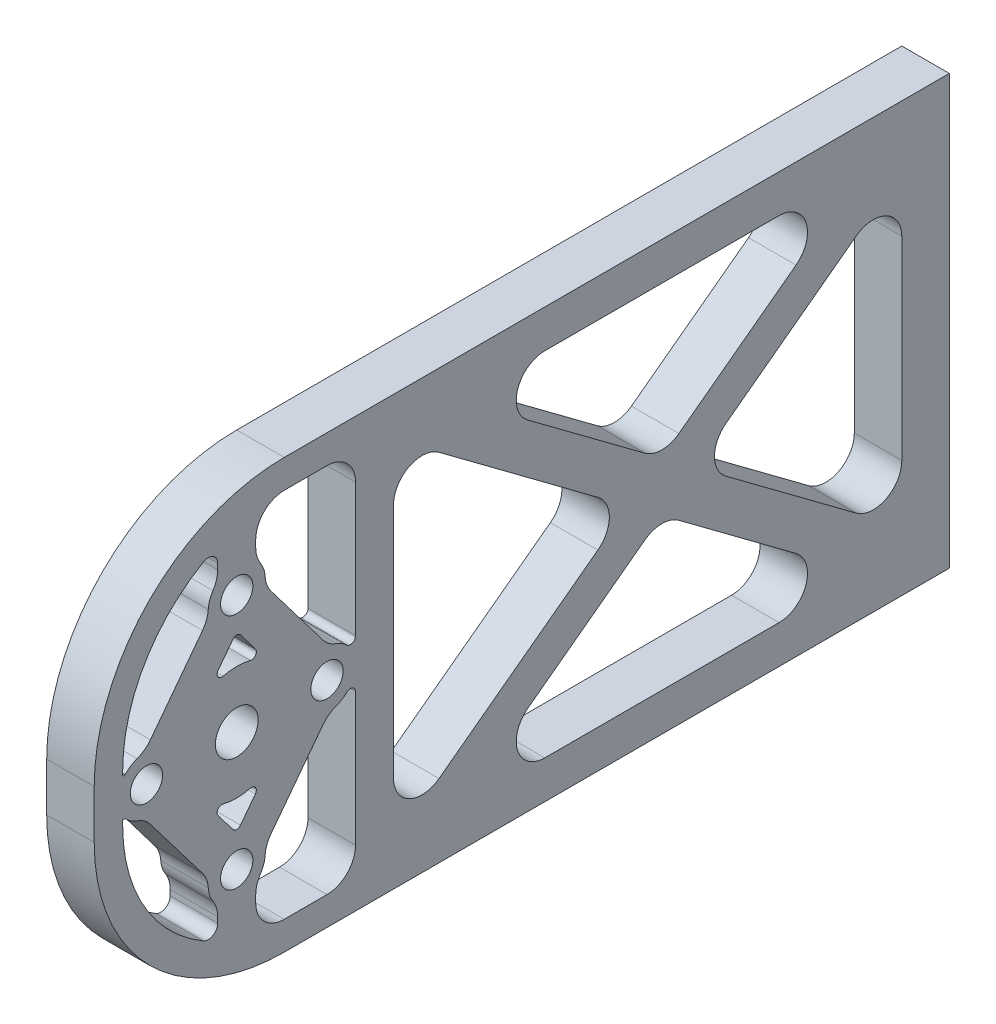
from build123d import *

# Parameters (mm, degrees)
SKETCH1_W           = 5
SKETCH1_H           = 45.1
BOSS_EXTRUDE1_DEPTH = 90
CUT_EXTRUDE1_DEPTH  = 3.9
SKETCH3_R           = 2.25
SKETCH3_R_2         = 1.7
CUT_EXTRUDE2_DEPTH  = 16.6
FILLET1_R           = 19.999999878
CUT_EXTRUDE8_DEPTH  = 15.24
FILLET3_R           = 3
FILLET4_R           = 3
FILLET6_DEPTH       = 5
FILLET7_DEPTH       = 5
FILLET8_R           = 3
FILLET9_R           = 1
FILLET10_R          = 1
FILLET14_R          = 3
FILLET15_R          = 0.5


with BuildPart() as part:
    # Sketch1 → Boss-Extrude1 (new body)
    with BuildSketch(Plane.XY):
        with Locations((2.5, 22.55)):
            Rectangle(SKETCH1_W, SKETCH1_H)
    extrude(amount=BOSS_EXTRUDE1_DEPTH)

    # Sketch2 → Cut-Extrude1 (cut)
    with BuildSketch(Plane(origin=(0, 0, 0), x_dir=(-1, 0, 0), z_dir=(0, 0, -1))):
        with BuildLine():
            ThreePointArc((-0.25, 37.55), (-0.909009742, 39.140990258), (-2.5, 39.8))
            Line((-2.5, 39.8), (-2.5, 35.3))
            ThreePointArc((-2.5, 35.3), (-0.909009742, 35.959009742), (-0.25, 37.55))
        make_face()
        with BuildLine():
            Line((-2.5, 35.3), (-2.5, 39.8))
            ThreePointArc((-2.5, 39.8), (-4.75, 37.55), (-2.5, 35.3))
        make_face()
        with BuildLine():
            ThreePointArc((-0.25, 7.55), (-0.909009742, 9.140990258), (-2.5, 9.8))
            Line((-2.5, 9.8), (-2.5, 5.3))
            ThreePointArc((-2.5, 5.3), (-0.909009742, 5.959009742), (-0.25, 7.55))
        make_face()
        with BuildLine():
            Line((-2.5, 5.3), (-2.5, 9.8))
            ThreePointArc((-2.5, 9.8), (-4.75, 7.55), (-2.5, 5.3))
        make_face()
    extrude(amount=-CUT_EXTRUDE1_DEPTH, mode=Mode.SUBTRACT)

    # Sketch3 → Cut-Extrude2 (cut)
    with BuildSketch(Plane.ZY):
        with Locations((75, 22.55)):
            Circle(SKETCH3_R)
        with Locations((84.5, 22.55)):
            Circle(SKETCH3_R_2)
        with Locations((65.5, 22.55)):
            Circle(SKETCH3_R_2)
        with Locations((75, 10.05)):
            Circle(SKETCH3_R_2)
        with Locations((75, 35.05)):
            Circle(SKETCH3_R_2)
    extrude(amount=-CUT_EXTRUDE2_DEPTH, mode=Mode.SUBTRACT)

    # Fillet1
    fillet1_edges = [part.edges().sort_by_distance(p)[0] for p in [
        (2.5, 45.1, 90),
        (2.5, 0, 90),
    ]]
    fillet(fillet1_edges, radius=FILLET1_R)

    # Sketch4 → Cut-Extrude8 (cut)
    with BuildSketch(Plane.ZY):
        with BuildLine():
            Line((70.000000122, 42.1), (63.145751292, 42.1))
            ThreePointArc((63.145751292, 42.1), (62.834437577, 41.851861901), (62.499999981, 41.635898385))
            Line((62.499999981, 41.635898385), (62.499999981, 24.55))
            Line((62.499999981, 24.55), (63.263932023, 24.55))
            ThreePointArc((63.263932023, 24.55), (64.16691137, 25.237540642), (65.26068293, 25.540439322))
            Line((65.26068293, 25.540439322), (72.054668294, 34.479893748))
            ThreePointArc((72.054668294, 34.479893748), (72.156985777, 36.007742202), (73, 37.286067977))
            Line((73, 37.286067977), (73, 41.833200551))
            ThreePointArc((73, 41.833200551), (71.505920207, 42.033168773), (70.000000122, 42.1))
        make_face()
        with BuildLine():
            ThreePointArc((87, 25.100000122), (84.282856855, 34.319544546), (77, 40.591933428))
            Line((77, 40.591933428), (77, 37.286067977))
            ThreePointArc((77, 37.286067977), (77.738612788, 36.274744871), (78, 35.05))
            ThreePointArc((78, 35.05), (77.986301653, 34.763639318), (77.945331706, 34.479893748))
            Line((77.945331706, 34.479893748), (84.73931707, 25.540439322))
            ThreePointArc((84.73931707, 25.540439322), (85.83308863, 25.237540642), (86.736067977, 24.55))
            Line((86.736067977, 24.55), (87, 24.55))
            Line((87, 24.55), (87, 25.100000122))
        make_face()
        with BuildLine():
            Line((87, 19.999999878), (87, 20.55))
            Line((87, 20.55), (86.736067977, 20.55))
            ThreePointArc((86.736067977, 20.55), (85.83308863, 19.862459358), (84.73931707, 19.559560678))
            Line((84.73931707, 19.559560678), (77.945331706, 10.620106252))
            ThreePointArc((77.945331706, 10.620106252), (77.986301653, 10.336360682), (78, 10.05))
            ThreePointArc((78, 10.05), (77.738612788, 8.825255129), (77, 7.813932023))
            Line((77, 7.813932023), (77, 4.508066572))
            ThreePointArc((77, 4.508066572), (84.282856855, 10.780455454), (87, 19.999999878))
        make_face()
        with BuildLine():
            Line((71.929872481, 17.394971677), (75, 13.355330204))
            Line((75, 13.355330204), (78.070127519, 17.394971677))
            ThreePointArc((78.070127519, 17.394971677), (75, 16.55), (71.929872481, 17.394971677))
        make_face()
        with BuildLine():
            Line((78.070127519, 27.705028323), (75, 31.744669796))
            Line((75, 31.744669796), (71.929872481, 27.705028323))
            ThreePointArc((71.929872481, 27.705028323), (75, 28.55), (78.070127519, 27.705028323))
        make_face()
        with BuildLine():
            ThreePointArc((62.499999981, 3.464101615), (62.834437577, 3.248138099), (63.145751292, 3))
            Line((63.145751292, 3), (70.000000122, 3))
            ThreePointArc((70.000000122, 3), (71.505920207, 3.066831227), (73, 3.266799449))
            Line((73, 3.266799449), (73, 7.813932023))
            ThreePointArc((73, 7.813932023), (72.156985777, 9.092257798), (72.054668294, 10.620106252))
            Line((72.054668294, 10.620106252), (65.26068293, 19.559560678))
            ThreePointArc((65.26068293, 19.559560678), (64.16691137, 19.862459358), (63.263932023, 20.55))
            Line((63.263932023, 20.55), (62.499999981, 20.55))
            Line((62.499999981, 20.55), (62.499999981, 3.464101615))
        make_face()
        Polygon((58.499999981, 40.989807049), (33.763673459, 22.55), (58.499999981, 4.110192951), (58.499999981, 22.550000019), align=None)
        Polygon((51.620472856, 4), (30.249999991, 19.930716141), (8.879527125, 4), align=None)
        Polygon((26.736326522, 22.55), (5, 38.753443412), (5, 6.346556588), align=None)
        Polygon((51.620472856, 41.1), (8.879527125, 41.1), (30.24999999, 25.169283859), align=None)
    extrude(amount=-CUT_EXTRUDE8_DEPTH, mode=Mode.SUBTRACT)

    # Fillet3
    fillet3_edges = [part.edges().sort_by_distance(p)[0] for p in [
        (2.5, 22.55, 33.763673459),
        (2.5, 40.989807049, 58.499999981),
        (2.5, 4.110192951, 58.499999981),
        (2.5, 38.753443412, 5),
        (2.5, 22.55, 26.736326522),
        (2.5, 6.346556588, 5),
        (2.5, 19.930716141, 30.249999991),
        (2.5, 4, 51.620472856),
        (2.5, 4, 8.879527125),
        (2.5, 41.1, 8.879527125),
        (2.5, 41.1, 51.620472856),
        (2.5, 25.169283859, 30.24999999),
    ]]
    fillet(fillet3_edges, radius=FILLET3_R)

    # Fillet4
    # the kernel refuses this fillet: 3 mm, written as the material it adds along each edge
    with BuildSketch(Plane(origin=(0, 41.635898385, 62.499999981), x_dir=(0, -1, 0), z_dir=(1, 0, 0))) as fillet4_piece_1:
        with BuildLine():
            CenterArc((2.535898385, -3), FILLET4_R, 90, 90)
            Line((-0.464101615, -3), (-0.764101615, -3))
            ThreePointArc((-0.764101615, -3), (-0.764101615, -0.645751311), (-0.259807621, 0.15))
            Line((-0.259807621, 0.15), (0, 0.3))
            Line((0, 0.3), (2.535898385, 0.3))
            Line((2.535898385, 0.3), (2.535898385, 0))
        make_face()
    extrude(amount=5)
    with BuildSketch(Plane(origin=(0, 42.1, 63.145751292), x_dir=(0, -0.977608773427827, -0.21043071571645502), z_dir=(1, 0, 0))) as fillet4_piece_2:
        with BuildLine():
            CenterArc((2.437420084, -2.93282632), FILLET4_R, 77.852405527, 90)
            Line((-0.495406237, -2.301534173), (-0.788688869, -2.238404958))
            Line((-0.788688869, -2.238404958), (-0.293282632, 0.063129215))
            Line((-0.293282632, 0.063129215), (-0.178205923, 0.241335138))
            ThreePointArc((-0.178205923, 0.241335138), (0.652724936, 0.826913544), (3.131841446, 0.293282632))
            Line((3.131841446, 0.293282632), (3.068712231, 0))
        make_face()
    extrude(amount=5)

    # Fillet6: read off the stored shape, not the designer's step
    # Fillet6 outline → Fillet6 (add)
    with BuildSketch(Plane.YZ):
        with BuildLine():
            add(Edge.make_bspline(
                [(24.550000002, 63.035898372), (24.550000007, 62.701238666), (24.793297494, 62.499999979), (25.085898405, 62.499999981)],
                knots=[0.347174193, 0.347174193, 0.347174193, 0.347174193, 1, 1, 1, 1], degree=3, weights=[0.723179501, 0.641942058, 0.734215557, 1]))
            Line((24.550000002, 63.035898372), (24.55, 62.499999981))
            Line((24.55, 62.499999981), (25.085898405, 62.499999981))
        make_face()
        with BuildLine():
            add(Edge.make_bspline(
                [(24.701559333, 63.409355976), (24.608835926, 63.313930877), (24.549999999, 63.184973167), (24.550000002, 63.035898372)],
                knots=[0, 0, 0, 0, 0.347174193, 0.347174193, 0.347174193, 0.347174193], degree=3, weights=[1, 0.858655251, 0.766381752, 0.723179501]))
            ThreePointArc((24.701559333, 63.409355976), (24.627052781, 63.335317173), (24.55, 63.263932023))
            Line((24.55, 63.263932023), (24.550000002, 63.035898372))
        make_face()
    extrude(amount=FILLET6_DEPTH)

    # Fillet7: read off the stored shape, not the designer's step
    # Fillet7 outline → Fillet7 (add)
    with BuildSketch(Plane.YZ):
        with BuildLine():
            add(Edge.make_bspline(
                [(20.55, 63.035898371), (20.550000002, 63.184973166), (20.491164076, 63.313930876), (20.398440668, 63.409355974)],
                knots=[0.652825805, 0.652825805, 0.652825805, 0.652825805, 1, 1, 1, 1], degree=3, weights=[0.723179502, 0.766381752, 0.858655251, 1]))
            Line((20.55, 63.035898371), (20.55, 63.263932023))
            ThreePointArc((20.55, 63.263932023), (20.47294722, 63.335317172), (20.398440668, 63.409355974))
        make_face()
        with BuildLine():
            add(Edge.make_bspline(
                [(20.014101602, 62.499999981), (20.306702509, 62.499999981), (20.549999995, 62.701238667), (20.55, 63.035898371)],
                knots=[0, 0, 0, 0, 0.652825805, 0.652825805, 0.652825805, 0.652825805], degree=3, weights=[1, 0.734215559, 0.641942059, 0.723179502]))
            Line((20.014101602, 62.499999981), (20.55, 62.499999981))
            Line((20.55, 62.499999981), (20.55, 63.035898371))
        make_face()
    extrude(amount=FILLET7_DEPTH)

    # Fillet8
    fillet8_edges = [part.edges().sort_by_distance(p)[0] for p in [
        (2.5, 25.540439322, 84.73931707),
        (2.5, 19.559560678, 84.73931707),
        (2.5, 7.813932023, 77),
        (2.5, 10.620106252, 77.945331706),
        (2.5, 37.286067977, 77),
        (2.5, 34.479893748, 77.945331706),
        (2.5, 41.833200551, 73),
        (2.5, 3.266799449, 73),
        (2.5, 7.813932023, 73),
        (2.5, 10.620106252, 72.054668294),
        (2.5, 34.479893748, 72.054668294),
        (2.5, 37.286067977, 73),
        (2.5, 25.540439322, 65.26068293),
        (2.5, 19.559560678, 65.26068293),
    ]]
    fillet(fillet8_edges, radius=FILLET8_R - 0.0001)  # a hair under: the kernel refuses the full size

    # Fillet9
    fillet9_edges = [part.edges().sort_by_distance(p)[0] for p in [
        (2.5, 40.591933428, 77),
    ]]
    fillet(fillet9_edges, radius=FILLET9_R)

    # Fillet10
    fillet10_edges = [part.edges().sort_by_distance(p)[0] for p in [
        (2.5, 4.508066572, 77),
    ]]
    fillet(fillet10_edges, radius=FILLET10_R)

    # Fillet14
    # the kernel refuses this fillet: 3 mm, written as the material it adds along each edge
    with BuildSketch(Plane(origin=(0, 3, 63.145751292), x_dir=(0, 0.977608773427827, -0.21043071571645502), z_dir=(1, 0, 0))) as fillet14_piece_1:
        with BuildLine():
            CenterArc((2.437420084, 2.93282632), FILLET14_R, 192.147594473, 90)
            Line((-0.495406237, 2.301534173), (-0.788688869, 2.238404958))
            Line((-0.788688869, 2.238404958), (-0.293282632, -0.063129215))
            Line((-0.293282632, -0.063129215), (-0.178205923, -0.241335138))
            ThreePointArc((-0.178205923, -0.241335138), (0.652724936, -0.826913544), (3.131841446, -0.293282632))
            Line((3.131841446, -0.293282632), (3.068712231, 0))
        make_face()
    extrude(amount=5)
    with BuildSketch(Plane(origin=(0, 3.464101615, 62.499999981), x_dir=(0, 1, 0), z_dir=(1, 0, 0))) as fillet14_piece_2:
        with BuildLine():
            CenterArc((2.535898385, 3), FILLET14_R, 180, 90)
            Line((-0.464101615, 3), (-0.764101615, 3))
            ThreePointArc((-0.764101615, 3), (-0.764101615, 0.645751311), (-0.259807621, -0.15))
            Line((-0.259807621, -0.15), (0, -0.3))
            Line((0, -0.3), (2.535898385, -0.3))
            Line((2.535898385, -0.3), (2.535898385, 0))
        make_face()
    extrude(amount=5)

    # Fillet15
    fillet15_edges = [part.edges().sort_by_distance(p)[0] for p in [
        (2.5, 17.394971677, 71.929872481),
        (2.5, 17.394971677, 78.070127519),
        (2.5, 13.355330204, 75),
        (2.5, 27.705028323, 78.070127519),
        (2.5, 27.705028323, 71.929872481),
        (2.5, 31.744669796, 75),
    ]]
    fillet(fillet15_edges, radius=FILLET15_R)


solid = part.part
